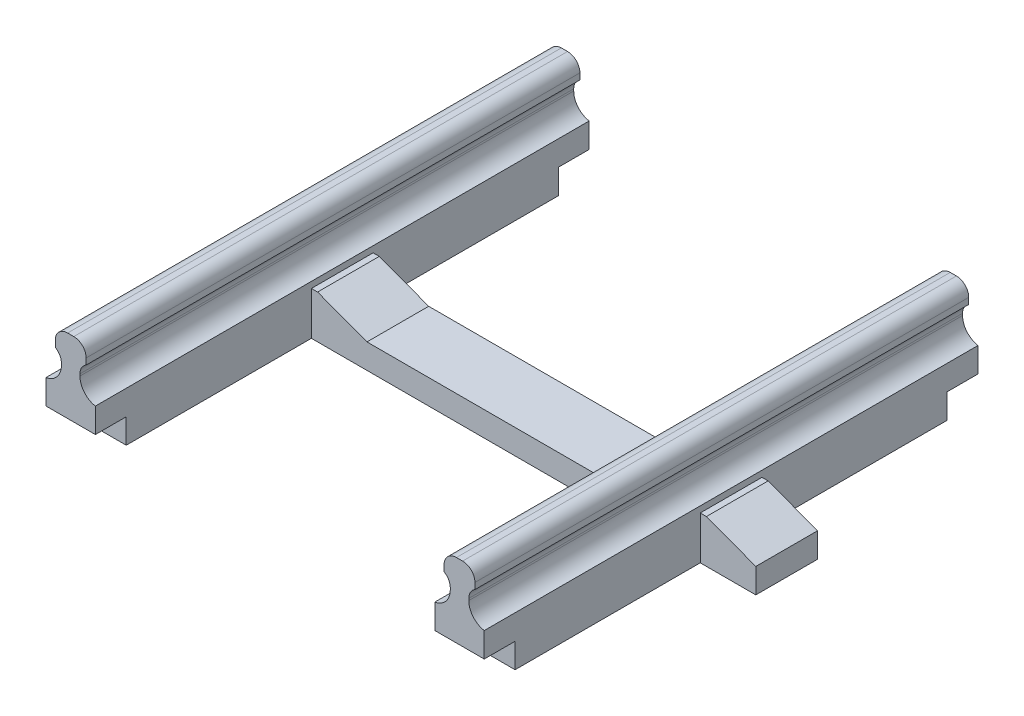
from build123d import *

# Parameters (mm, degrees)
SKETCH_1_W          = 4
SKETCH_1_H          = 17.5
SKETCH_1_H_2        = 5
EXTRUDE_1_DEPTH     = 4
SKETCH_1_7_W        = 44.5
SKETCH_1_7_H        = 5
EXTRUDE_2_DEPTH     = 3.5
SKETCH_2_W          = 18.5
SKETCH_2_H          = 1.5
CUT_EXTRUDE_1_DEPTH = 32.89533665
SKETCH_2_3_W        = 2.5
SKETCH_2_3_H        = 1.5
EXTRUDE_4_DEPTH     = 22.5
FILLET_1_R          = 1
FILLET_2_R          = 1.5
FILLET_3_R          = 1
SKETCH_5_W          = 2.5
SKETCH_5_H          = 2
CUT_EXTRUDE_2_DEPTH = 43.315038698
SKETCH_10_R         = 0.4
CUT_EXTRUDE_3_DEPTH = 2


with BuildPart() as part:
    # 草图1 → 凸台-拉伸1 (new body)
    with BuildSketch(Plane(origin=(0, 0, 0), x_dir=(1, 0, 0), z_dir=(0, 1, 0))):
        with Locations((-15.75, -2.5)):
            Rectangle(SKETCH_1_W, SKETCH_1_H)
        with Locations((15.75, -2.5)):
            Rectangle(SKETCH_1_W, SKETCH_1_H)
        with Locations((15.75, 8.75)):
            Rectangle(SKETCH_1_W, SKETCH_1_H_2)
        with Locations((-15.75, 8.75)):
            Rectangle(SKETCH_1_W, SKETCH_1_H_2)
    extrude(amount=EXTRUDE_1_DEPTH)

    # 草图1<7> → 凸台-拉伸2 (add)
    with BuildSketch(Plane(origin=(0, 0, 0), x_dir=(1, 0, 0), z_dir=(0, 1, 0))):
        with Locations((0, 8.75)):
            Rectangle(SKETCH_1_7_W, SKETCH_1_7_H)
    extrude(amount=EXTRUDE_2_DEPTH)

    # 草图2 → 切除-拉伸1 (cut, through all)
    with BuildSketch(Plane(origin=(0, 0, -11.25), x_dir=(-1, 0, 0), z_dir=(0, 0, -1))):
        with Locations((0, 2.75)):
            Rectangle(SKETCH_2_W, SKETCH_2_H)
        Polygon((13.25, 3.5), (9.25, 3.5), (9.25, 2), align=None)
        Polygon((-9.25, 3.5), (-13.25, 3.5), (-9.25, 2), align=None)
        Polygon((-22.25, 3.5), (-22.25, 2), (-18.25, 3.5), align=None)
        Polygon((22.25, 3.5), (18.25, 3.5), (22.25, 2), align=None)
    extrude(amount=-CUT_EXTRUDE_1_DEPTH, mode=Mode.SUBTRACT)

    # 草图2<3> → 凸台-拉伸4 (add, through all)
    with BuildSketch(Plane(origin=(0, 0, -11.25), x_dir=(-1, 0, 0), z_dir=(0, 0, -1))):
        with Locations((-15.75, 7.25)):
            Rectangle(SKETCH_2_3_W, SKETCH_2_3_H)
        Polygon((-15, 6.5), (-16.5, 6.5), (-16.5, 4), (-15.75, 4), (-15, 4), align=None)
        with Locations((15.75, 7.25)):
            Rectangle(SKETCH_2_3_W, SKETCH_2_3_H)
        Polygon((16.5, 6.5), (15, 6.5), (15, 4), (15.75, 4), (16.5, 4), align=None)
    extrude(amount=-EXTRUDE_4_DEPTH)

    # 圆角1
    # the kernel refuses this fillet: 1 mm, written as the material it adds along each edge
    with BuildSketch(Plane(origin=(-16.5, 6.5, -11.25), x_dir=(0, -1, 0), z_dir=(0, 0, 1))) as fillet_1_piece_1:
        with BuildLine():
            CenterArc((0.866025404, -1), FILLET_1_R, 90, 60)
            Line((0, -0.5), (-0.017320508, -0.49))
            ThreePointArc((-0.017320508, -0.49), (-0.02, -0.25), (-0.02, 0))
            Line((-0.02, 0), (0, 0.02))
            Line((0, 0.02), (0.866025404, 0.02))
            Line((0.866025404, 0.02), (0.866025404, 0))
        make_face()
    extrude(amount=22.5)
    with BuildSketch(Plane(origin=(-15, 6.5, -11.25), x_dir=(0, -1, 0), z_dir=(0, 0, 1)), Plane(origin=(16.5, 6.5, -11.25), x_dir=(0, -1, 0), z_dir=(0, 0, 1))) as fillet_1_piece_2:
        with BuildLine():
            CenterArc((0.866025404, 1), FILLET_1_R, 210, 60)
            Line((0, 0.5), (-0.017320508, 0.49))
            ThreePointArc((-0.017320508, 0.49), (-0.02, 0.25), (-0.02, 0))
            Line((-0.02, 0), (0, -0.02))
            Line((0, -0.02), (0.866025404, -0.02))
            Line((0.866025404, -0.02), (0.866025404, 0))
        make_face()
    extrude(amount=22.5)
    with BuildSketch(Plane(origin=(15, 6.5, -11.25), x_dir=(-1, 0, 0), z_dir=(0, 0, 1))) as fillet_1_piece_3:
        with BuildLine():
            CenterArc((1, 0.866025404), FILLET_1_R, 180, 60)
            Line((0, 0.866025404), (-0.02, 0.866025404))
            Line((-0.02, 0.866025404), (-0.02, 0))
            Line((-0.02, 0), (0, -0.02))
            ThreePointArc((0, -0.02), (0.25, -0.02), (0.49, -0.017320508))
            Line((0.49, -0.017320508), (0.5, 0))
        make_face()
    extrude(amount=22.5)

    # 圆角2
    # the kernel refuses this fillet: 1.5 mm, written as the material it adds along each edge
    with BuildSketch(Plane(origin=(16.5, 4, -11.25), x_dir=(1, 0, 0), z_dir=(0, 0, 1)), Plane(origin=(-15, 4, -11.25), x_dir=(1, 0, 0), z_dir=(0, 0, 1))) as fillet_2_piece_1:
        with BuildLine():
            CenterArc((1.5, 1.479019946), FILLET_2_R, 180, 80.405931773)
            Line((0, 1.479019946), (-0.03, 1.479019946))
            Line((-0.03, 1.479019946), (-0.03, 0))
            Line((-0.03, 0), (0, -0.03))
            ThreePointArc((0, -0.03), (0.625, -0.03), (1.245, -0.029580399))
            Line((1.245, -0.029580399), (1.25, 0))
        make_face()
    extrude(amount=22.5)
    with BuildSketch(Plane(origin=(15, 4, -11.25), x_dir=(0, 1, 0), z_dir=(0, 0, 1)), Plane(origin=(-16.5, 4, -11.25), x_dir=(0, 1, 0), z_dir=(0, 0, 1))) as fillet_2_piece_2:
        with BuildLine():
            CenterArc((1.479019946, 1.5), FILLET_2_R, 189.594068227, 80.405931773)
            Line((0, 1.25), (-0.029580399, 1.245))
            ThreePointArc((-0.029580399, 1.245), (-0.03, 0.625), (-0.03, 0))
            Line((-0.03, 0), (0, -0.03))
            Line((0, -0.03), (1.479019946, -0.03))
            Line((1.479019946, -0.03), (1.479019946, 0))
        make_face()
    extrude(amount=22.5)

    # 圆角3
    fillet_3_edges = [part.edges().sort_by_distance(p)[0] for p in [
        (14.5, 8, 0),
        (17, 8, 0),
        (-17, 8, 0),
        (-14.5, 8, 0),
    ]]
    fillet(fillet_3_edges, radius=FILLET_3_R)

    # 草图5 → 切除-拉伸2 (cut, through all)
    with BuildSketch(Plane(origin=(17.75, 0, 0), x_dir=(0, 0, -1), z_dir=(1, 0, 0))):
        with Locations((-10, 1)):
            Rectangle(SKETCH_5_W, SKETCH_5_H)
    extrude(amount=-CUT_EXTRUDE_2_DEPTH, mode=Mode.SUBTRACT)

    # 草图10 → 切除-拉伸3 (cut)
    with BuildSketch(Plane.XZ.offset(-2)):
        with Locations(Location((15.75, 10, 0), (0, 0, 270))):
            Circle(SKETCH_10_R)
        with Locations(Location((-15.75, 10, 0), (0, 0, 270))):
            Circle(SKETCH_10_R)
    extrude(amount=-CUT_EXTRUDE_3_DEPTH, mode=Mode.SUBTRACT)

    # 镜向1: part across plane


with BuildPart() as part_1:
    add(part.part)
    add(part.part.mirror(Plane(origin=(0, 0, -8.75), x_dir=(1, 0, 0), z_dir=(0, 0, -1))))


solid = part_1.part
